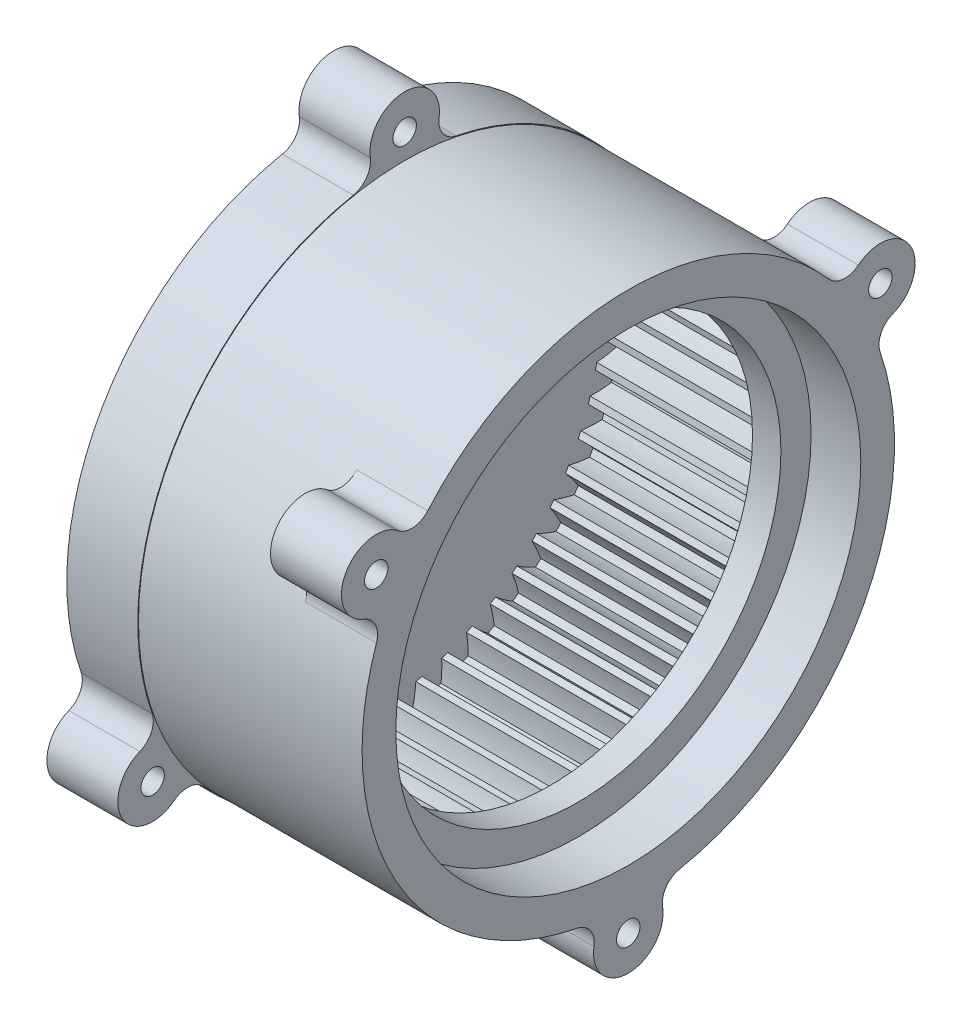
from build123d import *

# Parameters (mm, degrees)
BASPROSKE_W         = 26
BASPROSKE_H         = 4.375
TOOTHCUT_DEPTH      = 60.063525123
TEETHCUTS_COUNT     = 55
TEETHCUTS_ANGLE     = 353.454545455
SKETCH2_R           = 37.5
BOSS_EXTRUDE2_DEPTH = 4.5
SKETCH3_R           = 2.25
SKETCH3_R_2         = 1.8
CUT_EXTRUDE1_DEPTH  = 4.5
SKETCH4_R           = 3.25
CUT_EXTRUDE2_DEPTH  = 3
BOSS_EXTRUDE3_START = 4
SKETCH5_R           = 37.5
SKETCH5_R_2         = 28.5
BOSS_EXTRUDE3_DEPTH = 4
BOSS_EXTRUDE4_START = 7
SKETCH6_R           = 37.5
SKETCH6_R_2         = 32.75
BOSS_EXTRUDE4_DEPTH = 7
SKETCH7_R           = 1.65
BOSS_EXTRUDE5_DEPTH = 10
FILLET1_R           = 3
BOSS_EXTRUDE6_START = -10
SKETCH8_R           = 1.65
BOSS_EXTRUDE6_DEPTH = 10
FILLET2_R           = 3
SKETCH9_R           = 37.6
SKETCH9_R_2         = 37.5
BOSS_EXTRUDE7_DEPTH = 10
FILLET3_R           = 3


with BuildPart() as part:
    # BasProSke → Base-Revolve (revolve)
    with BuildSketch(Plane(origin=(0, 0, 0), x_dir=(1, 0, 0), z_dir=(0, 1, 0)), mode=Mode.PRIVATE) as base_revolve_sk:
        with Locations((13, 35.3125)):
            Rectangle(BASPROSKE_W, BASPROSKE_H)
    revolve(base_revolve_sk.sketch.rotate(Axis((-10, 0, 0), (1, 0, 0)), 180), axis=Axis((-10, 0, 0), (1, 0, 0)))

    # TooCutSke → ToothCut (cut, through all)
    with BuildSketch(Plane(origin=(0, 0, 0), x_dir=(0, 0, -1), z_dir=(1, 0, 0))):
        with BuildLine():
            ThreePointArc((1.451447951, 33.067761022), (1.040603726, 34.522224287), (0.503573985, 35.934971761))
            ThreePointArc((0.503573985, 35.934971761), (0, 35.9385), (-0.503573985, 35.934971761))
            ThreePointArc((-0.503573985, 35.934971761), (-1.040603726, 34.522224287), (-1.451447951, 33.067761022))
            ThreePointArc((-1.451447951, 33.067761022), (0, 33.0996), (1.451447951, 33.067761022))
        make_face()
    toothcut = extrude(amount=TOOTHCUT_DEPTH, mode=Mode.SUBTRACT)

    # TeethCuts: ToothCut ×55 about axis
    teethcuts_axis = Axis((-10, 0, 0), (1, 0, 0))
    for i in range(1, TEETHCUTS_COUNT):
        add(toothcut.rotate(teethcuts_axis, i * TEETHCUTS_ANGLE / (TEETHCUTS_COUNT - 1)), mode=Mode.SUBTRACT)

    # Sketch2 → Boss-Extrude2 (add)
    with BuildSketch(Plane.ZY):
        Circle(SKETCH2_R)
    extrude(amount=BOSS_EXTRUDE2_DEPTH)

    # Sketch3 → Cut-Extrude1 (cut)
    with BuildSketch(Plane.ZY.offset(4.5)):
        Circle(SKETCH3_R)
        with Locations((0, 8.5)):
            Circle(SKETCH3_R_2)
        with Locations(Location((0, -8.5, 0), (0, 0, 180))):
            Circle(SKETCH3_R_2)
    extrude(amount=-CUT_EXTRUDE1_DEPTH, mode=Mode.SUBTRACT)

    # Sketch4 → Cut-Extrude2 (cut)
    with BuildSketch(Plane(origin=(0, 0, 0), x_dir=(0, 0, -1), z_dir=(1, 0, 0))):
        with Locations((0, -8.5)):
            Circle(SKETCH4_R)
        with Locations((0, 8.5)):
            Circle(SKETCH4_R)
    extrude(amount=-CUT_EXTRUDE2_DEPTH, mode=Mode.SUBTRACT)

    # Sketch5 → Boss-Extrude3 (add)
    with BuildSketch(Plane(origin=(26, 0, 0), x_dir=(0, 0, -1), z_dir=(1, 0, 0)).offset(BOSS_EXTRUDE3_START)):
        with Locations(Location((0, 0, 0), (0, 0, 180))):
            Circle(SKETCH5_R)
        Circle(SKETCH5_R_2, mode=Mode.SUBTRACT)
    extrude(amount=-BOSS_EXTRUDE3_DEPTH)

    # Sketch6 → Boss-Extrude4 (add)
    with BuildSketch(Plane(origin=(30, 0, 0), x_dir=(0, 0, -1), z_dir=(1, 0, 0)).offset(BOSS_EXTRUDE4_START)):
        with Locations(Location((0, 0, 0), (0, 0, 180))):
            Circle(SKETCH6_R)
        Circle(SKETCH6_R_2, mode=Mode.SUBTRACT)
    extrude(amount=-BOSS_EXTRUDE4_DEPTH)

    # Sketch7 → Boss-Extrude5 (add)
    # profile 1 of 3: a face of its own
    with BuildSketch(Plane(origin=(37, 0, 0), x_dir=(0, 0, -1), z_dir=(1, 0, 0))):
        with BuildLine():
            ThreePointArc((-30.713496008, 21.515835168), (-39.750566034, 22.95), (-33.990007843, 15.840750198))
            ThreePointArc((-33.990007843, 15.840750198), (-32.475952642, 18.75), (-30.713496008, 21.515835168))
        make_face()
        with Locations((-35.507041555, 20.5)):
            Circle(SKETCH7_R, mode=Mode.SUBTRACT)
    # profile 2 of 3: a face of its own
    with BuildSketch(Plane(origin=(37, 0, 0), x_dir=(0, 0, -1), z_dir=(1, 0, 0))):
        with BuildLine():
            ThreePointArc((-3.276511835, -37.356585366), (0, -45.9), (3.276511835, -37.356585366))
            ThreePointArc((3.276511835, -37.356585366), (0, -37.5), (-3.276511835, -37.356585366))
        make_face()
        with Locations((0, -41)):
            Circle(SKETCH7_R, mode=Mode.SUBTRACT)
    # profile 3 of 3: a face of its own
    with BuildSketch(Plane(origin=(37, 0, 0), x_dir=(0, 0, -1), z_dir=(1, 0, 0))):
        with BuildLine():
            ThreePointArc((30.713496008, 21.515835168), (32.475952642, 18.75), (33.990007843, 15.840750198))
            ThreePointArc((33.990007843, 15.840750198), (39.750566034, 22.95), (30.713496008, 21.515835168))
        make_face()
        with Locations((35.507041555, 20.5)):
            Circle(SKETCH7_R, mode=Mode.SUBTRACT)
    extrude(amount=-BOSS_EXTRUDE5_DEPTH)

    # Fillet1
    fillet1_edges = [part.edges().sort_by_distance(p)[0] for p in [
        (32, 15.840750198, 33.990007843),
        (32, 21.515835168, 30.713496008),
        (32, -37.356585366, -3.276511835),
        (32, -37.356585366, 3.276511835),
        (32, 21.515835168, -30.713496008),
        (32, 15.840750198, -33.990007843),
    ]]
    fillet(fillet1_edges, radius=FILLET1_R)

    # Sketch8 → Boss-Extrude6 (add)
    # profile 1 of 3: a face of its own
    with BuildSketch(Plane.ZY.offset(4.5).offset(BOSS_EXTRUDE6_START)):
        with BuildLine():
            ThreePointArc((3.277032239, 37.357537298), (-0.001858552, 45.899133961), (-3.279499265, 37.357057531))
            ThreePointArc((-3.279499265, 37.357057531), (-0.001244018, 37.500865925), (3.277032239, 37.357537298))
        make_face()
        with Locations((0, 41)):
            Circle(SKETCH8_R, mode=Mode.SUBTRACT)
    # profile 2 of 3: a face of its own
    with BuildSketch(Plane.ZY.offset(4.5).offset(BOSS_EXTRUDE6_START)):
        with BuildLine():
            ThreePointArc((30.71426819, -21.517740103), (39.750655671, -22.948112687), (33.993202634, -15.837979147))
            ThreePointArc((33.993202634, -15.837979147), (32.478138639, -18.749677793), (30.71426819, -21.517740103))
        make_face()
        with Locations((35.507041555, -20.5)):
            Circle(SKETCH8_R, mode=Mode.SUBTRACT)
    # profile 3 of 3: a face of its own
    with BuildSketch(Plane.ZY.offset(4.5).offset(BOSS_EXTRUDE6_START)):
        with BuildLine():
            ThreePointArc((-30.712203543, -21.517680022), (-32.47526663, -18.751188157), (-33.989800256, -15.841195617))
            ThreePointArc((-33.989800256, -15.841195617), (-39.748976395, -22.951021278), (-30.712203543, -21.517680022))
        make_face()
        with Locations((-35.507041555, -20.5)):
            Circle(SKETCH8_R, mode=Mode.SUBTRACT)
    extrude(amount=BOSS_EXTRUDE6_DEPTH)


with BuildPart() as boss_extrude6_piece_1:
    # of the separate pieces the step leaves, piece 1, a body of its own (boss_extrude6_pieces)
    add(part.part.solids().sort_by_distance((37, -36.798102981, 7.221469172))[0])

    # Fillet2
    fillet2_edges = [boss_extrude6_piece_1.edges().sort_by_distance(p)[0] for p in [
        (0.5, -21.517680022, -30.712203543),
        (0.5, -15.841195617, -33.989800256),
    ]]
    fillet(fillet2_edges, radius=FILLET2_R)



with BuildPart() as boss_extrude6_piece_2:
    # of the separate pieces the step leaves, piece 2, a body of its own (boss_extrude6_pieces)
    add(part.part.solids().sort_by_distance((5.5, 37.357057531, -3.279499265))[0])


with BuildPart() as boss_extrude6_piece_3:
    # of the separate pieces the step leaves, piece 3, a body of its own (boss_extrude6_pieces)
    add(part.part.solids().sort_by_distance((5.5, -15.837979147, 33.993202634))[0])


with BuildPart() as boss_extrude6_piece_1_1:
    add(boss_extrude6_piece_1.part)

    add(boss_extrude6_piece_2.part)  # Boss-Extrude7 merges Boss-Extrude6 piece 2

    add(boss_extrude6_piece_3.part)  # Boss-Extrude7 merges Boss-Extrude6 piece 3
    # Sketch9 → Boss-Extrude7 (add)
    with BuildSketch(Plane.ZY.offset(4.5)):
        Circle(SKETCH9_R)
        Circle(SKETCH9_R_2, mode=Mode.SUBTRACT)
    extrude(amount=-BOSS_EXTRUDE7_DEPTH)

    # Fillet3
    fillet3_edges = [boss_extrude6_piece_1_1.edges().sort_by_distance(p)[0] for p in [
        (0.5, 37.448219223, 3.375037342),
        (0.5, 37.447972163, -3.377777505),
        (0.5, -21.646977688, 30.743590502),
        (0.5, -15.798744954, 34.119783966),
    ]]
    fillet(fillet3_edges, radius=FILLET3_R)


solid = boss_extrude6_piece_1_1.part
